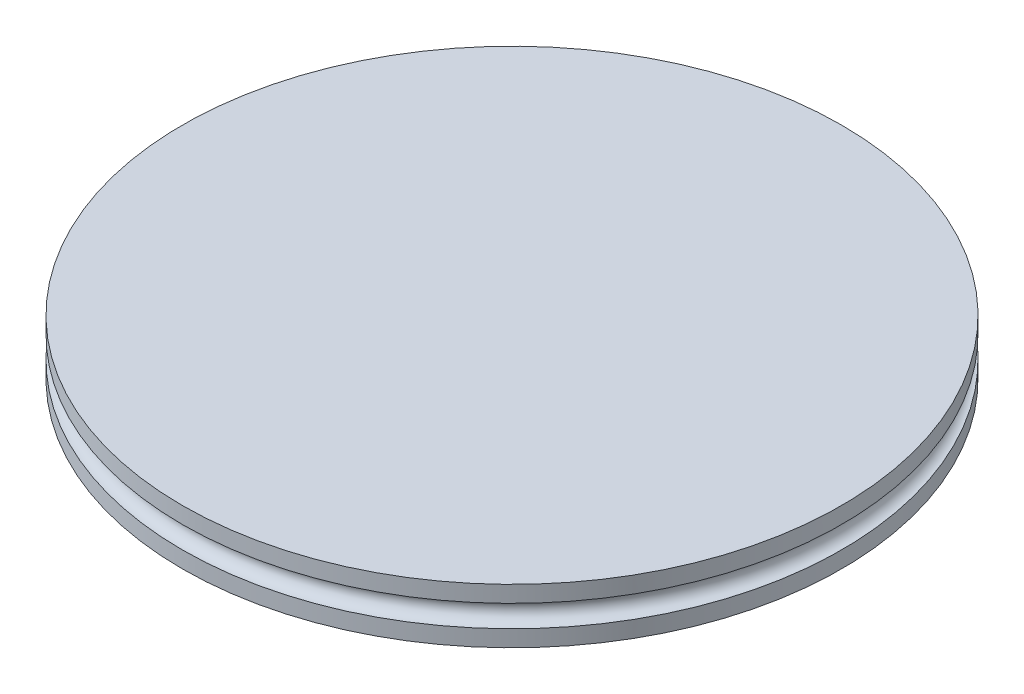
from build123d import *

# Parameters (mm, degrees)
SKETCH1_R           = 7.62
BOSS_EXTRUDE1_DEPTH = 1.27
SKETCH3_R           = 0.254
CUT_EXTRUDE1_DEPTH  = 25.4
SKETCH6_W           = 0.508
SKETCH6_H           = 0.508
CUT_EXTRUDE2_DEPTH  = 7.366
SKETCH7_W           = 0.508
SKETCH7_H           = 0.508
CUT_EXTRUDE3_DEPTH  = 7.366
SKETCH4_R           = 0.254


with BuildPart() as part:
    # Sketch1 → Boss-Extrude1 (new body)
    with BuildSketch(Plane(origin=(0, 0, 0), x_dir=(1, 0, 0), z_dir=(0, 1, 0))):
        Circle(SKETCH1_R)
    extrude(amount=BOSS_EXTRUDE1_DEPTH)

    # Sketch3 → Cut-Extrude1 (cut, symmetric)
    with BuildSketch(Plane.XY):
        with Locations((-7.112, 0.635)):
            Circle(SKETCH3_R)
    extrude(amount=CUT_EXTRUDE1_DEPTH, both=True, mode=Mode.SUBTRACT)

    # Sketch6 → Cut-Extrude2 (cut)
    with BuildSketch(Plane.XY.offset(-7.62)):
        with Locations((-7.366, 0.635)):
            Rectangle(SKETCH6_W, SKETCH6_H)
    extrude(amount=CUT_EXTRUDE2_DEPTH, mode=Mode.SUBTRACT)

    # Sketch7 → Cut-Extrude3 (cut)
    with BuildSketch(Plane.XY.offset(7.62)):
        with Locations((-7.366, 0.635)):
            Rectangle(SKETCH7_W, SKETCH7_H)
    extrude(amount=-CUT_EXTRUDE3_DEPTH, mode=Mode.SUBTRACT)

    # Cut-Sweep1: sweep along a path in Sketch5
    with BuildLine(Plane(origin=(0, 0, 0), x_dir=(1, 0, 0), z_dir=(0, 1, 0))) as cut_sweep1_path:
        ThreePointArc((-7.554809844, -0.994609585), (7.62, 0), (-7.554809844, 0.994609585))
    # Sketch4 → Cut-Sweep1 (sweep, cut)
    with BuildSketch(Plane.XY):
        with Locations((7.62, 0.635)):
            Circle(SKETCH4_R)
    sweep(path=cut_sweep1_path.line, mode=Mode.SUBTRACT)


solid = part.part
